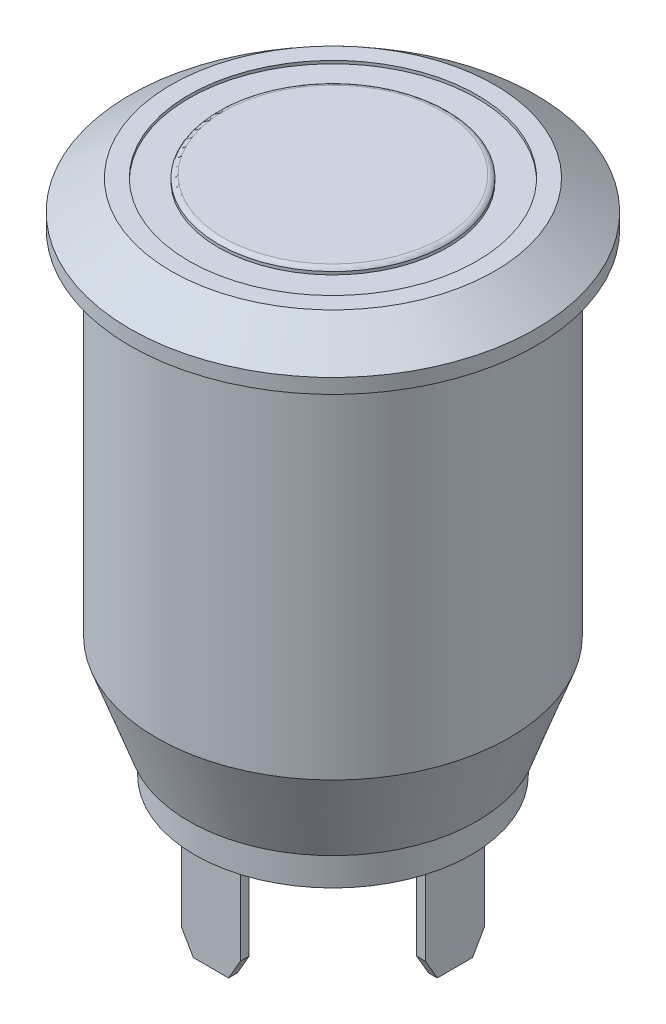
from build123d import *
from OCP.BRepFilletAPI import BRepFilletAPI_MakeChamfer

# Parameters (mm, degrees)
FILLET1_R           = 0.2
SKETCH2_R           = 4.9
SKETCH2_R_2         = 3.9
CUT_EXTRUDE1_DEPTH  = 0.1
SKETCH3_W           = 2
SKETCH3_H           = 0.3
SKETCH3_W_2         = 0.3
SKETCH3_H_2         = 2
EXTRUDE_THIN1_DEPTH = 3.6
CHAMFER1_SIZE       = 0.4
CHAMFER1_SIZE2      = 0.692820323
CHAMFER2_SIZE       = 3
CHAMFER2_SIZE2      = 1.091910703


with BuildPart() as part:
    # Sketch1 → Revolve1 (revolve)
    with BuildSketch(Plane(origin=(0, 0, 0), x_dir=(0, 0, -1), z_dir=(1, 0, 0))):
        Polygon((0, 1.6), (-3.9, 1.6), (-3.9, 1.5), (-5.5, 1.5), (-6.9, 0.5), (-6.9, 0), (-6, 0), (-6, -15), (-4.7, -15), (-4.7, -16.1), (0, -16.1), align=None)
    revolve(axis=Axis((0, 14.375, 0), (0, -1, 0)))

    # Fillet1
    # the kernel refuses this fillet: 0.2 mm, written as the material it takes off along each edge
    with BuildSketch(Plane(origin=(0, 1.6, 0), x_dir=(0, 0, 1), z_dir=(1, 0, 0))) as fillet1_piece_1:
        with BuildLine():
            CenterArc((3.726794919, 0.2), FILLET1_R, 270, 60)
            Line((3.9, 0.1), (3.903464102, 0.098))
            ThreePointArc((3.903464102, 0.098), (3.904, 0.05), (3.904, 0))
            Line((3.904, 0), (3.9, -0.004))
            Line((3.9, -0.004), (3.726794919, -0.004))
            Line((3.726794919, -0.004), (3.726794919, 0))
        make_face()
    revolve(axis=Axis((0, 1.6, 0), (0, -1, 0)), mode=Mode.SUBTRACT)

    # Sketch2 → Cut-Extrude1 (cut)
    with BuildSketch(Plane(origin=(0, 1.5, 0), x_dir=(1, 0, 0), z_dir=(0, 1, 0))):
        with Locations(Location((0, 0, 0), (0, 0, 270))):
            Circle(SKETCH2_R)
        with Locations(Location((0, 0, 0), (0, 0, 270))):
            Circle(SKETCH2_R_2, mode=Mode.SUBTRACT)
    extrude(amount=-CUT_EXTRUDE1_DEPTH, mode=Mode.SUBTRACT)

    # Sketch3 → Extrude-Thin1 (add)
    with BuildSketch(Plane.XZ.offset(16.1)):
        with Locations((0, 4)):
            Rectangle(SKETCH3_W, SKETCH3_H)
        with Locations((0, -4)):
            Rectangle(SKETCH3_W, SKETCH3_H)
        with Locations((-4, 0)):
            Rectangle(SKETCH3_W_2, SKETCH3_H_2)
        with Locations((4, 0)):
            Rectangle(SKETCH3_W_2, SKETCH3_H_2)
    extrude(amount=EXTRUDE_THIN1_DEPTH)

    # Chamfer1: one chamfer whose edges measure the first distance from different faces: ONE call of the kernel's chamfer builder (chamfer() names one face for all edges)
    chamfer1_edges_1 = [part.edges().sort_by_distance(p)[0] for p in [
        (1, -19.7, 4),
        (-1, -19.7, 4),
    ]]
    chamfer1_side_1 = [part.faces().sort_by_distance(p)[0] for p in [
        (0, -19.7, 4),
    ]]
    chamfer1_edges_2 = [part.edges().sort_by_distance(p)[0] for p in [
        (1, -19.7, -4),
        (-1, -19.7, -4),
    ]]
    chamfer1_side_2 = [part.faces().sort_by_distance(p)[0] for p in [
        (0, -19.7, -4),
    ]]
    chamfer1_edges_3 = [part.edges().sort_by_distance(p)[0] for p in [
        (-4, -19.7, -1),
        (-4, -19.7, 1),
    ]]
    chamfer1_side_3 = [part.faces().sort_by_distance(p)[0] for p in [
        (-4, -19.7, 0),
    ]]
    chamfer1_edges_4 = [part.edges().sort_by_distance(p)[0] for p in [
        (4, -19.7, 1),
        (4, -19.7, -1),
    ]]
    chamfer1_side_4 = [part.faces().sort_by_distance(p)[0] for p in [
        (4, -19.7, 0),
    ]]
    chamfer1 = BRepFilletAPI_MakeChamfer(part.part.solid().wrapped)
    for e in chamfer1_edges_1:
        chamfer1.Add(CHAMFER1_SIZE, CHAMFER1_SIZE2, e.wrapped, chamfer1_side_1[0].wrapped)  # the first distance lies on this face
    for e in chamfer1_edges_2:
        chamfer1.Add(CHAMFER1_SIZE, CHAMFER1_SIZE2, e.wrapped, chamfer1_side_2[0].wrapped)  # the first distance lies on this face
    for e in chamfer1_edges_3:
        chamfer1.Add(CHAMFER1_SIZE, CHAMFER1_SIZE2, e.wrapped, chamfer1_side_3[0].wrapped)  # the first distance lies on this face
    for e in chamfer1_edges_4:
        chamfer1.Add(CHAMFER1_SIZE, CHAMFER1_SIZE2, e.wrapped, chamfer1_side_4[0].wrapped)  # the first distance lies on this face
    add(Compound.cast(chamfer1.Shape()), mode=Mode.REPLACE)

    # Chamfer2
    chamfer2_edges = [part.edges().sort_by_distance(p)[0] for p in [
        (0, -15, -6),
    ]]
    chamfer2_side = [part.faces().sort_by_distance(p)[0] for p in [
        (0, -7.5, -6),
    ]]
    chamfer(chamfer2_edges, length=CHAMFER2_SIZE, length2=CHAMFER2_SIZE2, reference=chamfer2_side[0])


solid = part.part
